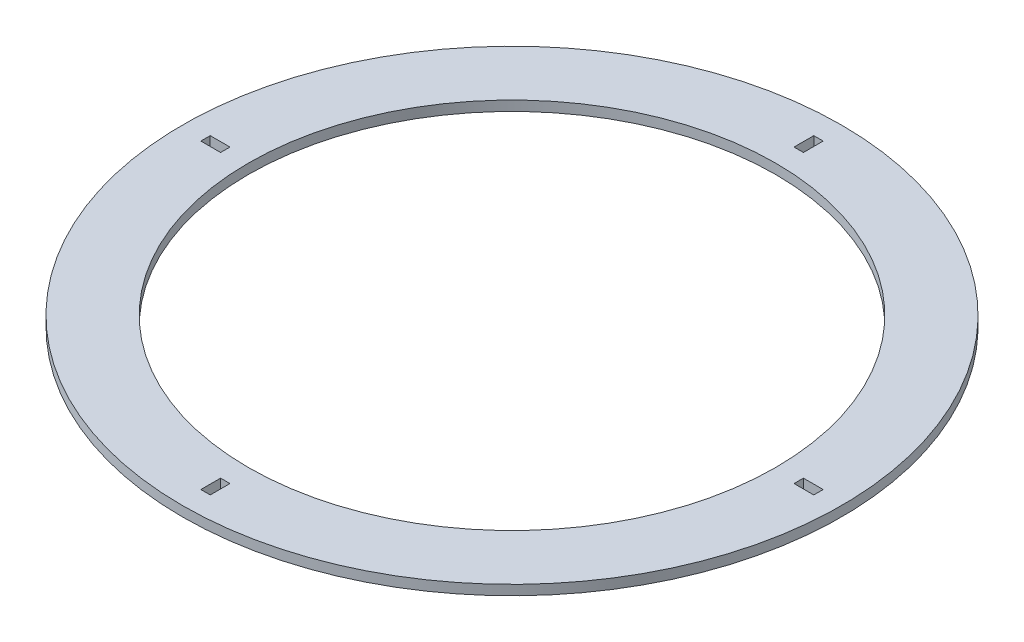
from build123d import *

# Parameters (mm, degrees)
SKETCH2_R           = 100
SKETCH2_R_2         = 80
BOSS_EXTRUDE1_DEPTH = 3
SKETCH3_W           = 2.85
SKETCH3_H           = 6
CUT_EXTRUDE1_DEPTH  = 142.453172464
CIRPATTERN1_COUNT   = 4


with BuildPart() as part:
    # Sketch2 → Boss-Extrude1 (new body)
    with BuildSketch(Plane(origin=(0, 0, 0), x_dir=(1, 0, 0), z_dir=(0, 1, 0))):
        Circle(SKETCH2_R)
        Circle(SKETCH2_R_2, mode=Mode.SUBTRACT)
    extrude(amount=BOSS_EXTRUDE1_DEPTH)

    # Sketch3 → Cut-Extrude1 (cut, through all)
    with BuildSketch(Plane(origin=(0, 3, 0), x_dir=(1, 0, 0), z_dir=(0, 1, 0))):
        with Locations((0, -90)):
            Rectangle(SKETCH3_W, SKETCH3_H)
    cut_extrude1 = extrude(amount=-CUT_EXTRUDE1_DEPTH, mode=Mode.SUBTRACT)

    # CirPattern1: Cut-Extrude1 ×4 about axis
    cirpattern1_axis = Axis((0, 3, 0), (0, -1, 0))
    for i in range(1, CIRPATTERN1_COUNT):
        add(cut_extrude1.rotate(cirpattern1_axis, i * 360 / CIRPATTERN1_COUNT), mode=Mode.SUBTRACT)


solid = part.part
